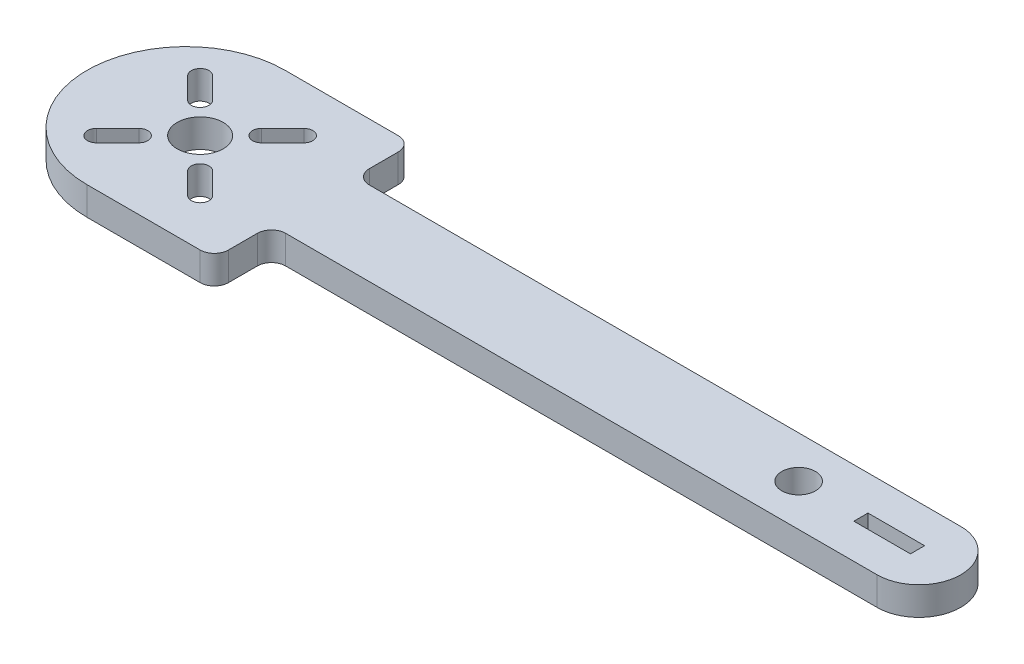
from build123d import *

# Parameters (mm, degrees)
SKETCH1_R           = 3.25
SKETCH1_R_2         = 2.38125
SKETCH1_W           = 8
SKETCH1_H           = 2
BOSS_EXTRUDE1_DEPTH = 4


with BuildPart() as part:
    # Sketch1 → Boss-Extrude1 (new body)
    with BuildSketch(Plane(origin=(0, 0, 0), x_dir=(1, 0, 0), z_dir=(0, 1, 0))):
        with BuildLine():
            Line((-50.8, 14), (-36.8, 14))
            ThreePointArc((-36.8, 14), (-35.385786438, 13.414213562), (-34.8, 12))
            Line((-34.8, 12), (-34.8, 7.914556152))
            ThreePointArc((-34.8, 7.914556152), (-34.214213562, 6.500342589), (-32.8, 5.914556152))
            Line((-32.8, 5.914556152), (50.8, 5.914556152))
            ThreePointArc((50.8, 5.914556152), (56.714556152, 0), (50.8, -5.914556152))
            Line((50.8, -5.914556152), (-32.8, -5.914556152))
            ThreePointArc((-32.8, -5.914556152), (-34.214213562, -6.500342589), (-34.8, -7.914556152))
            Line((-34.8, -7.914556152), (-34.8, -12))
            ThreePointArc((-34.8, -12), (-35.385786438, -13.414213562), (-36.8, -14))
            Line((-36.8, -14), (-50.8, -14))
            Line((-50.8, -14), (-52.8, -14))
            ThreePointArc((-52.8, -14), (-66.8, 0), (-52.8, 14))
            Line((-52.8, 14), (-50.8, 14))
        make_face()
        with Locations((-50.8, 0)):
            Circle(SKETCH1_R, mode=Mode.SUBTRACT)
        with Locations((33.8, 0)):
            Circle(SKETCH1_R_2, mode=Mode.SUBTRACT)
        with BuildLine():
            Line((-57.252349378, 8.220116331), (-54.247145558, 5.214912511))
            ThreePointArc((-54.247145558, 5.214912511), (-54.247145558, 3.447145558), (-56.014912511, 3.447145558))
            Line((-56.014912511, 3.447145558), (-59.020116331, 6.452349378))
            ThreePointArc((-59.020116331, 6.452349378), (-59.020116331, 8.220116331), (-57.252349378, 8.220116331))
        make_face(mode=Mode.SUBTRACT)
        with BuildLine():
            Line((-42.579883669, 6.452349378), (-45.585087489, 3.447145558))
            ThreePointArc((-45.585087489, 3.447145558), (-47.352854442, 3.447145558), (-47.352854442, 5.214912511))
            Line((-47.352854442, 5.214912511), (-44.347650622, 8.220116331))
            ThreePointArc((-44.347650622, 8.220116331), (-42.579883669, 8.220116331), (-42.579883669, 6.452349378))
        make_face(mode=Mode.SUBTRACT)
        with BuildLine():
            Line((-44.347650622, -8.220116331), (-47.352854442, -5.214912511))
            ThreePointArc((-47.352854442, -5.214912511), (-47.352854442, -3.447145558), (-45.585087489, -3.447145558))
            Line((-45.585087489, -3.447145558), (-42.579883669, -6.452349378))
            ThreePointArc((-42.579883669, -6.452349378), (-42.579883669, -8.220116331), (-44.347650622, -8.220116331))
        make_face(mode=Mode.SUBTRACT)
        with BuildLine():
            Line((-59.020116331, -6.452349378), (-56.014912511, -3.447145558))
            ThreePointArc((-56.014912511, -3.447145558), (-54.247145558, -3.447145558), (-54.247145558, -5.214912511))
            Line((-54.247145558, -5.214912511), (-57.252349378, -8.220116331))
            ThreePointArc((-57.252349378, -8.220116331), (-59.020116331, -8.220116331), (-59.020116331, -6.452349378))
        make_face(mode=Mode.SUBTRACT)
        with Locations((46.6, 0)):
            Rectangle(SKETCH1_W, SKETCH1_H, mode=Mode.SUBTRACT)
    extrude(amount=BOSS_EXTRUDE1_DEPTH)


solid = part.part
